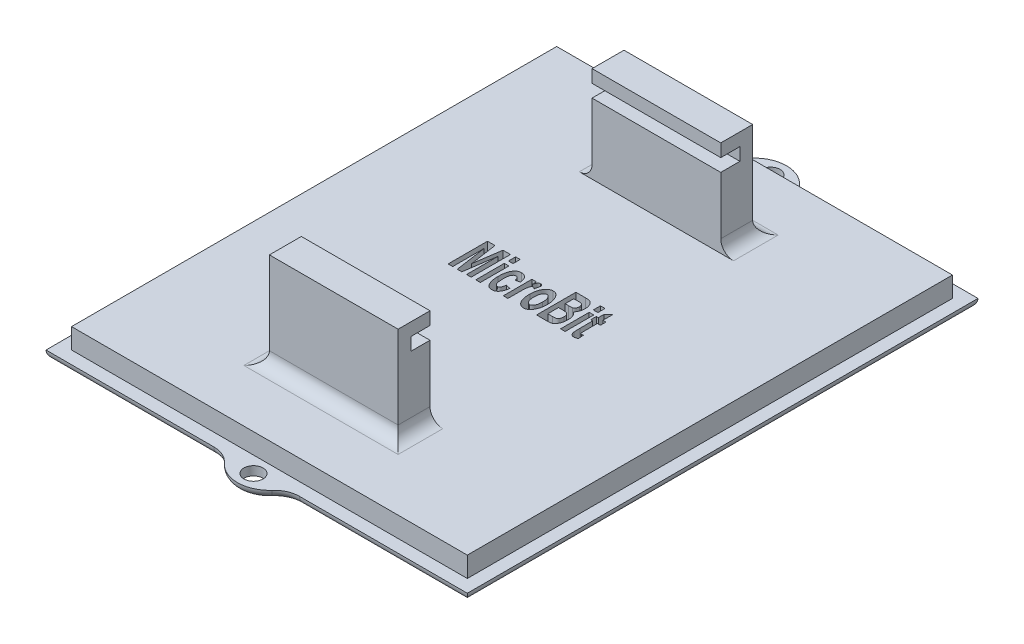
from build123d import *

# Parameters (mm, degrees)
SKETCH1_W           = 62
SKETCH1_H           = 76
BOSS_EXTRUDE1_DEPTH = 4.575
SKETCH11_W          = 66
SKETCH11_H          = 80
BOSS_EXTRUDE5_DEPTH = 1.4
BOSS_EXTRUDE3_DEPTH = 1.4
CUT_EXTRUDE3_REACH  = 56.296
SKETCH12_R          = 1.5
FILLET1_R           = 1.4
SKETCH5_W           = 0.720463423
SKETCH5_H           = 1.12072088
SKETCH5_H_2         = 4.482883523
SKETCH5_W_2         = 0.720463424
LETTERS_DEPTH       = 2
SKETCH21_W          = 20.158508521
SKETCH21_H          = 5
BOSS_EXTRUDE8_DEPTH = 15
SKETCH33_W          = 3
SKETCH33_H          = 2
CUT_EXTRUDE7_DEPTH  = 25
FILLET2_R           = 2


with BuildPart() as part:
    # Sketch1 → Boss-Extrude1 (new body)
    with BuildSketch(Plane(origin=(0, 0, 0), x_dir=(1, 0, 0), z_dir=(0, 1, 0))):
        Rectangle(SKETCH1_W, SKETCH1_H)
    extrude(amount=BOSS_EXTRUDE1_DEPTH)

    # Sketch11 → Boss-Extrude5 (add)
    with BuildSketch(Plane(origin=(0, 0, 0), x_dir=(-1, 0, 0), z_dir=(0, -1, 0))):
        Rectangle(SKETCH11_W, SKETCH11_H)
    extrude(amount=-BOSS_EXTRUDE5_DEPTH)

    # Sketch4 → Boss-Extrude3 (add)
    with BuildSketch(Plane(origin=(0, 0, 0), x_dir=(1, 0, 0), z_dir=(0, 1, 0))):
        with BuildLine():
            Line((-6.708203932, -40), (6.708203932, -40))
            ThreePointArc((6.708203932, -40), (5.075210771, -40.348516283), (3.726779962, -41.333333333))
            ThreePointArc((3.726779962, -41.333333333), (0, -43), (-3.726779962, -41.333333333))
            ThreePointArc((-3.726779962, -41.333333333), (-5.075210771, -40.348516283), (-6.708203932, -40))
        make_face()
    boss_extrude3 = extrude(amount=BOSS_EXTRUDE3_DEPTH)

    # Sketch12 → Cut-Extrude3 (cut, up to next)
    with BuildSketch(Plane(origin=(0, 1.4, 0), x_dir=(1, 0, 0), z_dir=(0, 1, 0)), mode=Mode.PRIVATE) as cut_extrude3_sk1:
        with Locations(Location((0, -40.5, 0), (0, 0, 270))):
            Circle(SKETCH12_R)
    cut_extrude3_tool1 = extrude(cut_extrude3_sk1.sketch, amount=-CUT_EXTRUDE3_REACH, mode=Mode.PRIVATE) & part.part
    cut_extrude3 = cut_extrude3_tool1.solids().sort_by_distance((0, 1.4, 40.5))[0]
    add(cut_extrude3, mode=Mode.SUBTRACT)

    # Mirror1: Boss-Extrude3, Cut-Extrude3 across plane
    add(boss_extrude3.mirror(Plane.XY))
    add(cut_extrude3.mirror(Plane.XY), mode=Mode.SUBTRACT)

    # Fillet1
    # the kernel refuses this fillet: 1.4 mm, written as the material it takes off along each edge
    with BuildSketch(Plane(origin=(6.708203932, 0, -40), x_dir=(0, 0, 1), z_dir=(1, 0, 0)), Plane(origin=(-36.5, 0, -40), x_dir=(0, 0, 1), z_dir=(1, 0, 0)), Plane(origin=(-6.708203932, 0, 40), x_dir=(0, 0, -1), z_dir=(-1, 0, 0)), Plane(origin=(36.5, 0, 40), x_dir=(0, 0, -1), z_dir=(-1, 0, 0))) as fillet1_piece_1:
        with BuildLine():
            CenterArc((FILLET1_R, -FILLET1_R), FILLET1_R, 90, 90)
            Line((0, -FILLET1_R), (0, 0))
            Line((0, 0), (FILLET1_R, 0))
        make_face()
    extrude(amount=29.791796068, mode=Mode.SUBTRACT)
    with BuildSketch(Plane(origin=(6.708203932, 0, -44), x_dir=(0, 0, 1), z_dir=(1, 0, 0))) as fillet1_piece_2:
        with BuildLine():
            CenterArc((4 + FILLET1_R, -FILLET1_R), FILLET1_R, 90, 90)
            Line((4, -FILLET1_R), (4, 0))
            Line((4, 0), (4 + FILLET1_R, 0))
        make_face()
    revolve(axis=Axis((6.708203932, 0, -44), (0, -1, 0)), revolution_arc=48.189685104, mode=Mode.SUBTRACT)
    with BuildSketch(Plane(origin=(0, 0, -38), x_dir=(0.7453559924999292, 0, -0.6666666666666675), z_dir=(0.6666666666666675, 0, 0.7453559924999292))) as fillet1_piece_3:
        with BuildLine():
            CenterArc((5 - FILLET1_R, FILLET1_R), FILLET1_R, 270, 90)
            Line((5, FILLET1_R), (5, 0))
            Line((5, 0), (5 - FILLET1_R, 0))
        make_face()
    revolve(axis=Axis((0, 0, -38), (0, 1, 0)), revolution_arc=96.379370208, mode=Mode.SUBTRACT)
    with BuildSketch(Plane(origin=(-6.708203932, 0, -44), x_dir=(0.7453559924999359, 0, 0.6666666666666601), z_dir=(0.6666666666666601, 0, -0.7453559924999359))) as fillet1_piece_4:
        with BuildLine():
            CenterArc((4 + FILLET1_R, -FILLET1_R), FILLET1_R, 90, 90)
            Line((4, -FILLET1_R), (4, 0))
            Line((4, 0), (4 + FILLET1_R, 0))
        make_face()
    revolve(axis=Axis((-6.708203932, 0, -44), (0, -1, 0)), revolution_arc=48.189685104, mode=Mode.SUBTRACT)
    with BuildSketch(Plane(origin=(-33, 0, 43.5), x_dir=(1, 0, 0), z_dir=(0, 0, -1)), Plane(origin=(33, 0, -43.5), x_dir=(-1, 0, 0), z_dir=(0, 0, 1))) as fillet1_piece_5:
        with BuildLine():
            CenterArc((FILLET1_R, -FILLET1_R), FILLET1_R, 90, 90)
            Line((0, -FILLET1_R), (0, 0))
            Line((0, 0), (FILLET1_R, 0))
        make_face()
    extrude(amount=87, mode=Mode.SUBTRACT)
    with BuildSketch(Plane(origin=(-6.708203932, 0, 44), x_dir=(0.7453559924999359, 0, -0.6666666666666601), z_dir=(0.6666666666666601, 0, 0.7453559924999359))) as fillet1_piece_6:
        with BuildLine():
            CenterArc((4 + FILLET1_R, FILLET1_R), FILLET1_R, 180, 90)
            Line((4, FILLET1_R), (4, 0))
            Line((4, 0), (4 + FILLET1_R, 0))
        make_face()
    revolve(axis=Axis((-6.708203932, 0, 44), (0, 1, 0)), revolution_arc=48.189685104, mode=Mode.SUBTRACT)
    with BuildSketch(Plane(origin=(0, 0, 38), x_dir=(0.7453559924999292, 0, 0.6666666666666675), z_dir=(0.6666666666666675, 0, -0.7453559924999292))) as fillet1_piece_7:
        with BuildLine():
            CenterArc((5 - FILLET1_R, -FILLET1_R), FILLET1_R, 0, 90)
            Line((5, -FILLET1_R), (5, 0))
            Line((5, 0), (5 - FILLET1_R, 0))
        make_face()
    revolve(axis=Axis((0, 0, 38), (0, -1, 0)), revolution_arc=96.379370208, mode=Mode.SUBTRACT)
    with BuildSketch(Plane(origin=(6.708203932, 0, 44), x_dir=(0, 0, -1), z_dir=(1, 0, 0))) as fillet1_piece_8:
        with BuildLine():
            CenterArc((4 + FILLET1_R, FILLET1_R), FILLET1_R, 180, 90)
            Line((4, FILLET1_R), (4, 0))
            Line((4, 0), (4 + FILLET1_R, 0))
        make_face()
    revolve(axis=Axis((6.708203932, 0, 44), (0, 1, 0)), revolution_arc=48.189685104, mode=Mode.SUBTRACT)

    # Sketch5 → Letters (cut)
    # profile 1 of 10: a face of its own
    with BuildSketch(Plane(origin=(0, 4.575, 0), x_dir=(1, 0, 0), z_dir=(0, 1, 0))):
        Polygon((-10.006436435, 0), (-10.006436435, 6.163964844), (-8.82692774, 6.163964844), (-8.205277876, 1.878708441), (-7.569869163, 6.163964844), (-6.404119318, 6.163964844), (-6.404119318, 0), (-7.124582741, 0), (-7.124582741, 4.931922358), (-7.85755421, 0), (-8.569262002, 0), (-9.285973011, 4.931922358), (-9.285973011, 0), align=None)
    # profile 2 of 10: a face of its own
    with BuildSketch(Plane(origin=(0, 4.575, 0), x_dir=(1, 0, 0), z_dir=(0, 1, 0))):
        with Locations((-5.323424184, 5.683655895)):
            Rectangle(SKETCH5_W, SKETCH5_H)
    # profile 3 of 10: a face of its own
    with BuildSketch(Plane(origin=(0, 4.575, 0), x_dir=(1, 0, 0), z_dir=(0, 1, 0))):
        with Locations((-5.323424184, 2.241441761)):
            Rectangle(SKETCH5_W, SKETCH5_H_2)
    # profile 4 of 10: a face of its own
    with BuildSketch(Plane(origin=(0, 4.575, 0), x_dir=(1, 0, 0), z_dir=(0, 1, 0))):
        with BuildLine():
            Line((-1.841184304, 3.202059659), (-2.561647727, 3.041956676))
            add(Edge.make_bspline(
                [(-2.561647727, 3.041956676), (-2.569415767, 3.092175905), (-2.58406832, 3.186902496), (-2.619771712, 3.318313553), (-2.667104922, 3.429656101), (-2.724529075, 3.522184519), (-2.794601312, 3.594585136), (-2.876949236, 3.645999071), (-2.970591912, 3.677119835), (-3.036713652, 3.680585796), (-3.070725181, 3.682368608)],
                knots=[0, 0, 0, 0, 1.347443994, 2.541631543, 3.60183602, 4.546855086, 5.415025027, 6.249789833, 7.099731444, 8, 8, 8, 8], degree=3))
            add(Edge.make_bspline(
                [(-3.070725181, 3.682368608), (-3.093340453, 3.681480194), (-3.137837925, 3.679732164), (-3.202158584, 3.663700201), (-3.263895926, 3.640121901), (-3.320926661, 3.60421503), (-3.376111323, 3.560183489), (-3.425297488, 3.503981254), (-3.473400881, 3.440107338), (-3.517468375, 3.365664951), (-3.55614382, 3.279071411), (-3.591377271, 3.180200304), (-3.619545923, 3.067457298), (-3.641400643, 2.941073356), (-3.660106052, 2.801743554), (-3.673926442, 2.648612112), (-3.68097533, 2.482081661), (-3.681892186, 2.366528182), (-3.682368608, 2.306483598)],
                knots=[0, 0, 0, 0, 0.653952693, 1.286707604, 1.910173864, 2.56054813, 3.23014942, 3.948308205, 4.716418548, 5.544914348, 6.447474048, 7.459723416, 8.58159871, 9.808722421, 11.173440023, 12.652828902, 14.260723113, 16, 16, 16, 16], degree=3))
            add(Edge.make_bspline(
                [(-3.682368608, 2.306483598), (-3.681951943, 2.240181062), (-3.681152388, 2.112950383), (-3.673344585, 1.92943313), (-3.661954944, 1.7611394), (-3.642368234, 1.607755771), (-3.620844281, 1.469382679), (-3.593699631, 1.345447483), (-3.560164675, 1.237256559), (-3.522628532, 1.142818846), (-3.479900577, 1.062067335), (-3.433158987, 0.992997984), (-3.384879837, 0.93309132), (-3.331449406, 0.885033815), (-3.275017186, 0.846446471), (-3.214108085, 0.820543468), (-3.150519744, 0.802866536), (-3.106703335, 0.801306174), (-3.084484031, 0.800514915)],
                knots=[0, 0, 0, 0, 1.798001022, 3.450258536, 4.980924576, 6.370801408, 7.642305822, 8.777998934, 9.808017779, 10.710903135, 11.53035003, 12.2798791, 12.970457311, 13.610893161, 14.222428263, 14.814848151, 15.399009397, 16, 16, 16, 16], degree=3))
            add(Edge.make_bspline(
                [(-3.084484031, 0.800514915), (-3.051606238, 0.802904842), (-2.986663507, 0.807625609), (-2.894914444, 0.846201993), (-2.813814247, 0.90901051), (-2.756630384, 0.979719625), (-2.715954214, 1.048924052), (-2.685589559, 1.111295227), (-2.660549472, 1.184422762), (-2.635110558, 1.265546173), (-2.612769772, 1.356213883), (-2.593087009, 1.456006846), (-2.57541787, 1.565299764), (-2.566363112, 1.64143361), (-2.561647727, 1.681081321)],
                knots=[0, 0, 0, 0, 1.052803843, 2.079578714, 3.139931458, 4.319283822, 4.973649928, 5.716166048, 6.541994899, 7.452471082, 8.446066745, 9.538310016, 10.718042264, 12, 12, 12, 12], degree=3))
            Line((-2.561647727, 1.681081321), (-1.841184304, 1.520978338))
            add(Edge.make_bspline(
                [(-1.841184304, 1.520978338), (-1.850438105, 1.45622145), (-1.868427924, 1.330331043), (-1.907060708, 1.149142847), (-1.948384373, 0.97953323), (-1.998736088, 0.823049194), (-2.054719727, 0.678732173), (-2.117182974, 0.546895782), (-2.185909331, 0.427446867), (-2.261117666, 0.320558724), (-2.342566616, 0.225511461), (-2.431778586, 0.144457341), (-2.526328825, 0.074181423), (-2.628293346, 0.01792899), (-2.736605027, -0.026228261), (-2.851257408, -0.057368176), (-2.9720923, -0.076656507), (-3.054808336, -0.078904867), (-3.096992077, -0.080051491)],
                knots=[0, 0, 0, 0, 1.397562585, 2.716926754, 3.957387357, 5.126818082, 6.227165444, 7.263413005, 8.241524602, 9.168586725, 10.052913959, 10.910625063, 11.739335748, 12.564974991, 13.392295341, 14.233179615, 15.098952307, 16, 16, 16, 16], degree=3))
            add(Edge.make_bspline(
                [(-3.096992077, -0.080051491), (-3.150563194, -0.078488552), (-3.255422485, -0.075429277), (-3.406793666, -0.04083068), (-3.548920331, 0.010305846), (-3.677793377, 0.088331835), (-3.798040664, 0.183087123), (-3.904818851, 0.302120925), (-4.001431065, 0.440918055), (-4.086400893, 0.599288964), (-4.160007795, 0.772452367), (-4.224996746, 0.955050223), (-4.280391007, 1.146294258), (-4.324893358, 1.346049654), (-4.360151575, 1.554785401), (-4.384636945, 1.771919108), (-4.400108793, 1.997726191), (-4.401913409, 2.150941184), (-4.402832031, 2.228933716)],
                knots=[0, 0, 0, 0, 0.871335986, 1.705539791, 2.518217913, 3.322216255, 4.148776725, 5.004773818, 5.917026023, 6.898996254, 7.927594745, 8.980563789, 10.055657359, 11.169882491, 12.313627008, 13.503576332, 14.729220965, 16, 16, 16, 16], degree=3))
            add(Edge.make_bspline(
                [(-4.402832031, 2.228933716), (-4.401464905, 2.321097387), (-4.39880889, 2.500150355), (-4.383123899, 2.760305847), (-4.354825608, 3.003881155), (-4.313328635, 3.23010435), (-4.262728792, 3.439724466), (-4.200798883, 3.632209339), (-4.12529997, 3.80699595), (-4.039427746, 3.965174689), (-3.943046365, 4.10496164), (-3.840461345, 4.227821972), (-3.729784115, 4.331543425), (-3.611523579, 4.415946868), (-3.486350805, 4.482388376), (-3.353385693, 4.528276056), (-3.21345524, 4.558854501), (-3.11717024, 4.56155978), (-3.068223572, 4.562935014)],
                knots=[0, 0, 0, 0, 1.480403806, 2.876086558, 4.184392852, 5.416521724, 6.568123854, 7.646082557, 8.65997895, 9.622034346, 10.532252541, 11.382870141, 12.188398895, 12.961453918, 13.710344977, 14.455904881, 15.215056218, 16, 16, 16, 16], degree=3))
            add(Edge.make_bspline(
                [(-3.068223572, 4.562935014), (-3.028575991, 4.561978344), (-2.951068687, 4.560108142), (-2.837706838, 4.545364597), (-2.730870416, 4.518172298), (-2.628459995, 4.483778744), (-2.532109001, 4.437153394), (-2.441354684, 4.380223844), (-2.35596462, 4.313898678), (-2.276546593, 4.236534842), (-2.202405506, 4.148825752), (-2.134903594, 4.048409506), (-2.070739743, 3.937297863), (-2.013759748, 3.813123011), (-1.962504233, 3.677133045), (-1.91671003, 3.529577007), (-1.875061966, 3.370190792), (-1.852718978, 3.259304988), (-1.841184304, 3.202059659)],
                knots=[0, 0, 0, 0, 0.943294595, 1.844052543, 2.712659931, 3.562887164, 4.410389768, 5.25270882, 6.108014149, 6.977980152, 7.886191725, 8.835518475, 9.853144629, 10.936129977, 12.082166347, 13.308999365, 14.610757988, 16, 16, 16, 16], degree=3))
        make_face()
    # profile 5 of 10: a face of its own
    with BuildSketch(Plane(origin=(0, 4.575, 0), x_dir=(1, 0, 0), z_dir=(0, 1, 0))):
        with BuildLine():
            Line((-0.640411932, 0), (-1.360875355, 0))
            Line((-1.360875355, 0), (-1.360875355, 4.482883523))
            Line((-1.360875355, 4.482883523), (-0.640411932, 4.482883523))
            Line((-0.640411932, 4.482883523), (-0.640411932, 3.846224005))
            add(Edge.make_bspline(
                [(-0.640411932, 3.846224005), (-0.628032007, 3.881710365), (-0.604222872, 3.949957916), (-0.568019215, 4.047139641), (-0.533652779, 4.135209589), (-0.497971226, 4.212131681), (-0.466340695, 4.280608732), (-0.433256796, 4.3381647), (-0.402642575, 4.387093409), (-0.363561579, 4.438297371), (-0.310897715, 4.486909117), (-0.243882034, 4.531455931), (-0.1702871, 4.557728926), (-0.119440816, 4.561190242), (-0.093810342, 4.562935014)],
                knots=[0, 0, 0, 0, 1.407544315, 2.706996432, 3.88427009, 4.946569811, 5.882446341, 6.707549214, 7.430927138, 8.043118681, 9.114674348, 10.097942534, 11.041215361, 12, 12, 12, 12], degree=3))
            add(Edge.make_bspline(
                [(-0.093810342, 4.562935014), (-0.057499169, 4.560374916), (0.0163768, 4.555166333), (0.123013261, 4.507701002), (0.22715949, 4.436812131), (0.28799561, 4.372886912), (0.320205966, 4.339040999)],
                knots=[0, 0, 0, 0, 0.895150057, 1.821204655, 2.846412748, 4, 4, 4, 4], degree=3))
            Line((0.320205966, 4.339040999), (0.09881356, 3.328390919))
            add(Edge.make_bspline(
                [(0.09881356, 3.328390919), (0.073039233, 3.357709895), (0.025622976, 3.411647139), (-0.053003521, 3.472875252), (-0.129771301, 3.513825744), (-0.182626594, 3.519554995), (-0.207633556, 3.522265625)],
                knots=[0, 0, 0, 0, 1.252290691, 2.303801736, 3.197492555, 4, 4, 4, 4], degree=3))
            add(Edge.make_bspline(
                [(-0.207633556, 3.522265625), (-0.229639464, 3.52071238), (-0.274728029, 3.51752989), (-0.33822927, 3.485962544), (-0.397521354, 3.437817591), (-0.452009653, 3.368912645), (-0.501922222, 3.276114318), (-0.539687108, 3.153243943), (-0.572809098, 3.00184035), (-0.594089467, 2.853964111), (-0.60597155, 2.713879934), (-0.616766771, 2.584720539), (-0.623336704, 2.434930556), (-0.629748341, 2.264823385), (-0.634487829, 2.074267294), (-0.638660607, 1.862882625), (-0.63901791, 1.630630335), (-0.639934657, 1.468860783), (-0.640411932, 1.384640642)],
                knots=[0, 0, 0, 0, 0.455174481, 0.932620676, 1.444745929, 2.036817955, 2.747170909, 3.625029935, 4.700533201, 5.971547284, 6.72946565, 7.625692715, 8.668005912, 9.848617431, 11.167690078, 12.634014002, 14.247607075, 16, 16, 16, 16], degree=3))
            Line((-0.640411932, 1.384640642), (-0.640411932, 0))
        make_face()
    # profile 6 of 10: a face of its own
    with BuildSketch(Plane(origin=(0, 4.575, 0), x_dir=(1, 0, 0), z_dir=(0, 1, 0))):
        with BuildLine():
            add(Edge.make_bspline(
                [(0.480308949, 2.303981989), (0.482718128, 2.410404936), (0.487447001, 2.619297988), (0.524330571, 2.924803604), (0.584192604, 3.215729644), (0.654189875, 3.44645854), (0.721069658, 3.62070998), (0.774824186, 3.742241597), (0.832314928, 3.855740557), (0.894662842, 3.959599876), (0.959161195, 4.056501008), (1.026986066, 4.144932464), (1.100454193, 4.224223623), (1.200272744, 4.317731505), (1.332969224, 4.41670896), (1.506455338, 4.501223603), (1.690074006, 4.554252872), (1.81623215, 4.560021214), (1.879959245, 4.562935014)],
                knots=[0, 0, 0, 0, 1.739754581, 3.414889862, 5.023331204, 6.591153363, 7.350788374, 8.07413214, 8.763188209, 9.429614607, 10.053576947, 10.665847298, 11.249635028, 11.818789968, 12.901436432, 13.941117902, 14.959983318, 16, 16, 16, 16], degree=3))
            add(Edge.make_bspline(
                [(1.879959245, 4.562935014), (1.933046037, 4.560597105), (2.037650664, 4.555990384), (2.190319172, 4.524747015), (2.333397853, 4.469822792), (2.467972255, 4.394112047), (2.59180668, 4.294448764), (2.709616239, 4.176488695), (2.815529428, 4.034511318), (2.911446457, 3.874056077), (2.998163387, 3.699808397), (3.074409184, 3.516396001), (3.137966043, 3.325586796), (3.190838276, 3.128076017), (3.232254616, 2.923015094), (3.260266219, 2.710272619), (3.278425502, 2.49066588), (3.280870012, 2.341959703), (3.282111151, 2.266457852)],
                knots=[0, 0, 0, 0, 0.856934198, 1.688542078, 2.502308837, 3.322121042, 4.170421256, 5.060418754, 6.006761195, 7.021391695, 8.074902537, 9.146109931, 10.225217581, 11.319085367, 12.445034116, 13.599666462, 14.781290534, 16, 16, 16, 16], degree=3))
            add(Edge.make_bspline(
                [(3.282111151, 2.266457852), (3.279702671, 2.155037599), (3.27498971, 1.937008178), (3.238317266, 1.618088898), (3.177366411, 1.315462152), (3.105745267, 1.076253744), (3.039160642, 0.895668989), (2.983595442, 0.77098824), (2.926478295, 0.65407386), (2.864913584, 0.545713575), (2.798917162, 0.445791916), (2.728677102, 0.354655163), (2.656181088, 0.270844958), (2.554319833, 0.174665884), (2.420778555, 0.073835606), (2.248793019, -0.014471243), (2.068495554, -0.070144368), (1.94455312, -0.07674482), (1.882460854, -0.080051491)],
                knots=[0, 0, 0, 0, 1.777630946, 3.478504418, 5.114714351, 6.697655826, 7.457657535, 8.184525214, 8.87481742, 9.533342784, 10.171800573, 10.78392461, 11.368492025, 11.937908158, 13.017048985, 14.025738842, 15.010941249, 16, 16, 16, 16], degree=3))
            add(Edge.make_bspline(
                [(1.882460854, -0.080051491), (1.833126014, -0.078071948), (1.735688516, -0.074162302), (1.592736214, -0.044663392), (1.456530956, 0.00472561), (1.326717089, 0.073150446), (1.202968725, 0.159960419), (1.087454894, 0.268417315), (0.977409696, 0.394795437), (0.875310156, 0.540516082), (0.781019832, 0.703094758), (0.700214212, 0.883454331), (0.632944724, 1.080521363), (0.576778372, 1.293239774), (0.533410071, 1.522747193), (0.502552839, 1.768779725), (0.483675368, 2.031009951), (0.481450837, 2.211389948), (0.480308949, 2.303981989)],
                knots=[0, 0, 0, 0, 0.771958132, 1.524635918, 2.274108935, 3.033183731, 3.81547548, 4.633024056, 5.50737879, 6.434585393, 7.414184396, 8.445393942, 9.522888597, 10.670700671, 11.886797803, 13.176461281, 14.550630786, 16, 16, 16, 16], degree=3))
        make_face()
        with BuildLine():
            add(Edge.make_bspline(
                [(1.200772372, 2.241441761), (1.201709427, 2.187235755), (1.203527084, 2.082089392), (1.211324187, 1.929186695), (1.228459928, 1.786615238), (1.248348101, 1.653853467), (1.277702182, 1.531551095), (1.312439238, 1.419606331), (1.351866675, 1.316787343), (1.399732662, 1.226173642), (1.450897085, 1.145108213), (1.506364806, 1.075676176), (1.561695934, 1.013914774), (1.622840186, 0.966794875), (1.684808712, 0.927821508), (1.749801831, 0.900485902), (1.817753256, 0.882976234), (1.864008265, 0.881377248), (1.887464072, 0.880566406)],
                knots=[0, 0, 0, 0, 1.556678143, 3.019573961, 4.393142381, 5.678311651, 6.871720797, 8.000071596, 9.042671446, 10.027885058, 10.937779578, 11.790348481, 12.577999173, 13.310890625, 13.998691348, 14.674617145, 15.327901432, 16, 16, 16, 16], degree=3))
            add(Edge.make_bspline(
                [(1.887464072, 0.880566406), (1.910504059, 0.881377797), (1.95593857, 0.882977847), (2.022665627, 0.900488094), (2.086354842, 0.92790735), (2.1475261, 0.966738604), (2.206587326, 1.015338006), (2.261092095, 1.076912813), (2.315620388, 1.146629399), (2.364925626, 1.228502293), (2.411596044, 1.320170915), (2.452832121, 1.422509975), (2.486170335, 1.535763888), (2.513061277, 1.658779183), (2.536443312, 1.791755037), (2.549923511, 1.935627223), (2.561101291, 2.089503985), (2.561461915, 2.195554743), (2.561647727, 2.250197393)],
                knots=[0, 0, 0, 0, 0.660393245, 1.302285633, 1.967439311, 2.64530034, 3.37669002, 4.156479444, 5.002005497, 5.915997461, 6.896089777, 7.954620151, 9.079873129, 10.282682905, 11.570260259, 12.954922579, 14.431023942, 16, 16, 16, 16], degree=3))
            add(Edge.make_bspline(
                [(2.561647727, 2.250197393), (2.560709593, 2.303569396), (2.558890706, 2.407048951), (2.551118036, 2.557458426), (2.533866566, 2.697929202), (2.514076906, 2.82903785), (2.484762049, 2.950109564), (2.449735503, 3.06111373), (2.410607996, 3.16361409), (2.362408884, 3.254476916), (2.31163698, 3.335785251), (2.257568349, 3.406961251), (2.200260364, 3.466671526), (2.141243254, 3.516699671), (2.079006892, 3.554549818), (2.014495585, 3.582948745), (1.946676617, 3.599613887), (1.900475322, 3.6014182), (1.877457636, 3.602317116)],
                knots=[0, 0, 0, 0, 1.543216374, 2.992043267, 4.351050057, 5.633102205, 6.822942095, 7.947500436, 8.997225086, 9.989171339, 10.915455685, 11.766456908, 12.567781992, 13.303907758, 13.996408695, 14.66586955, 15.335330404, 16, 16, 16, 16], degree=3))
            add(Edge.make_bspline(
                [(1.877457636, 3.602317116), (1.854417982, 3.601505423), (1.808984128, 3.599904777), (1.742252193, 3.582398962), (1.678582178, 3.554962263), (1.617335345, 3.516199666), (1.55836736, 3.467135246), (1.502417334, 3.406484197), (1.448299194, 3.335815626), (1.397223771, 3.254817829), (1.350915588, 3.162647012), (1.309791121, 3.060737906), (1.276229528, 2.948389587), (1.249200001, 2.826221019), (1.22620711, 2.694436566), (1.212381447, 2.551857916), (1.201367874, 2.400048349), (1.200974398, 2.295249503), (1.200772372, 2.241441761)],
                knots=[0, 0, 0, 0, 0.66322814, 1.307876003, 1.975885011, 2.656655919, 3.391185263, 4.182498677, 5.031654351, 5.955929882, 6.940229476, 8.003303844, 9.121872868, 10.318114021, 11.611218606, 12.977903235, 14.448339751, 16, 16, 16, 16], degree=3))
        make_face(mode=Mode.SUBTRACT)
    # profile 7 of 10: a face of its own
    with BuildSketch(Plane(origin=(0, 4.575, 0), x_dir=(1, 0, 0), z_dir=(0, 1, 0))):
        with BuildLine():
            Line((3.842471591, 6.163964844), (5.344687861, 6.163964844))
            add(Edge.make_bspline(
                [(5.344687861, 6.163964844), (5.394304419, 6.163358765), (5.489409443, 6.162197035), (5.626390275, 6.156906642), (5.751903488, 6.143734353), (5.865881015, 6.128003087), (5.969063773, 6.108700313), (6.05988184, 6.08196877), (6.140573137, 6.053122416), (6.232635991, 6.004951992), (6.336566179, 5.927260289), (6.446626815, 5.806894435), (6.54901306, 5.66023481), (6.636142564, 5.486421928), (6.711263924, 5.293723251), (6.766575285, 5.08583764), (6.797599881, 4.864481309), (6.802078979, 4.713127052), (6.804376776, 4.635481678)],
                knots=[0, 0, 0, 0, 0.97292557, 1.864903826, 2.686450071, 3.445992779, 4.120937143, 4.741890865, 5.300647567, 5.797894589, 6.773974564, 7.826575111, 8.983142181, 10.270078414, 11.62877496, 13.0326338, 14.477728602, 16, 16, 16, 16], degree=3))
            add(Edge.make_bspline(
                [(6.804376776, 4.635481678), (6.802879102, 4.564089523), (6.799942083, 4.424085612), (6.771503534, 4.219743396), (6.726766126, 4.025703562), (6.664752838, 3.844812162), (6.589608852, 3.679987646), (6.501781744, 3.536171008), (6.403874215, 3.413410629), (6.32644753, 3.349336529), (6.289045299, 3.318384483)],
                knots=[0, 0, 0, 0, 1.172421032, 2.299181576, 3.38260476, 4.439807611, 5.435964538, 6.35240003, 7.204099777, 8, 8, 8, 8], degree=3))
            add(Edge.make_bspline(
                [(6.289045299, 3.318384483), (6.340434037, 3.288600308), (6.444296552, 3.228403087), (6.578210525, 3.1002024), (6.693458705, 2.944388815), (6.790466498, 2.761535751), (6.869114302, 2.554977096), (6.924662646, 2.32514533), (6.958579054, 2.074430655), (6.962468279, 1.900084663), (6.964479759, 1.80991419)],
                knots=[0, 0, 0, 0, 0.819022201, 1.655337504, 2.541002995, 3.49037165, 4.508760589, 5.589782824, 6.753453293, 8, 8, 8, 8], degree=3))
            add(Edge.make_bspline(
                [(6.964479759, 1.80991419), (6.963793382, 1.75402533), (6.962449908, 1.6446317), (6.950920566, 1.483901477), (6.932296354, 1.329840066), (6.906433481, 1.182312976), (6.872046198, 1.041829775), (6.83281435, 0.907202884), (6.7836287, 0.779515725), (6.727592849, 0.658997692), (6.667205221, 0.547303617), (6.602696945, 0.446555071), (6.537287213, 0.356263835), (6.467642476, 0.277595318), (6.395358009, 0.210483689), (6.321414899, 0.152639048), (6.242970005, 0.108569802), (6.188407861, 0.086967181), (6.161463235, 0.076299078)],
                knots=[0, 0, 0, 0, 1.329635076, 2.602551002, 3.83177101, 5.020743121, 6.163630403, 7.271539973, 8.354838235, 9.415600219, 10.432162945, 11.373324619, 12.26022279, 13.082400334, 13.868538126, 14.60463836, 15.310923385, 16, 16, 16, 16], degree=3))
            add(Edge.make_bspline(
                [(6.161463235, 0.076299078), (6.139432799, 0.070195214), (6.089973956, 0.056491898), (6.005213429, 0.040253755), (5.901823804, 0.029342914), (5.779771742, 0.01701204), (5.639062832, 0.011026095), (5.47941562, 0.004116803), (5.301340287, 0.000697009), (5.176246779, 0.000239439), (5.110787409, 0)],
                knots=[0, 0, 0, 0, 0.51936907, 1.1659957, 1.958061688, 2.881030339, 3.953150927, 5.157337786, 6.512481738, 8, 8, 8, 8], degree=3))
            Line((5.110787409, 0), (3.842471591, 0))
            Line((3.842471591, 0), (3.842471591, 6.163964844))
        make_face()
        with BuildLine():
            Line((4.562935014, 5.123295455), (4.562935014, 3.762420099))
            Line((4.562935014, 3.762420099), (5.0807681, 3.762420099))
            add(Edge.make_bspline(
                [(5.0807681, 3.762420099), (5.117876504, 3.762277558), (5.188343383, 3.762006881), (5.288398059, 3.763812353), (5.377233261, 3.764363761), (5.454752714, 3.767470768), (5.521117184, 3.769187815), (5.576086233, 3.773541162), (5.620046781, 3.77633037), (5.645317411, 3.780603314), (5.656138195, 3.782432972)],
                knots=[0, 0, 0, 0, 1.545743879, 2.935285125, 4.16852895, 5.245899403, 6.167053727, 6.933015916, 7.543121653, 8, 8, 8, 8], degree=3))
            add(Edge.make_bspline(
                [(5.656138195, 3.782432972), (5.688256219, 3.79079899), (5.750949942, 3.807129286), (5.837301617, 3.852445464), (5.911625904, 3.914429907), (5.974284423, 3.993200353), (6.024097076, 4.087213242), (6.058801861, 4.197377203), (6.079891597, 4.321975413), (6.082528272, 4.410246612), (6.083913352, 4.456616627)],
                knots=[0, 0, 0, 0, 0.911397765, 1.779029707, 2.659324076, 3.55739798, 4.533026168, 5.57113304, 6.72408443, 8, 8, 8, 8], degree=3))
            add(Edge.make_bspline(
                [(6.083913352, 4.456616627), (6.08256742, 4.498347299), (6.080012407, 4.577565554), (6.064838692, 4.691016122), (6.034390569, 4.791317525), (5.994596189, 4.879139751), (5.947374149, 4.953732338), (5.893667967, 5.013091306), (5.834601494, 5.057988092), (5.77806169, 5.081721255), (5.723798901, 5.095364356), (5.667414421, 5.101135861), (5.596296834, 5.109745308), (5.509778126, 5.113208783), (5.408137222, 5.11943695), (5.290892131, 5.120504025), (5.158336464, 5.124124706), (5.064928238, 5.123581555), (5.015726263, 5.123295455)],
                knots=[0, 0, 0, 0, 1.333735276, 2.531859112, 3.644437664, 4.669699927, 5.604525458, 6.453087242, 7.215050613, 7.954919955, 8.394301585, 8.999038448, 9.762514, 10.683186281, 11.7634788, 13.01590914, 14.428155952, 16, 16, 16, 16], degree=3))
            Line((5.015726263, 5.123295455), (4.562935014, 5.123295455))
        make_face(mode=Mode.SUBTRACT)
        with BuildLine():
            Line((4.562935014, 2.72175071), (4.562935014, 1.040669389))
            Line((4.562935014, 1.040669389), (5.298408092, 1.040669389))
            add(Edge.make_bspline(
                [(5.298408092, 1.040669389), (5.336766132, 1.041015903), (5.410154586, 1.041678869), (5.514855248, 1.043727999), (5.609124237, 1.048744448), (5.692643826, 1.055766972), (5.765143439, 1.066096462), (5.826828812, 1.076455998), (5.877282655, 1.090491361), (5.931659548, 1.10984438), (5.98947728, 1.147240339), (6.049705047, 1.206346223), (6.105777636, 1.280076547), (6.153039301, 1.370490304), (6.195411916, 1.474200439), (6.222755665, 1.592813613), (6.240666119, 1.723894395), (6.242865708, 1.815683162), (6.244016335, 1.863698786)],
                knots=[0, 0, 0, 0, 1.234790772, 2.362461338, 3.370455331, 4.273250416, 5.059029203, 5.727651389, 6.284414341, 6.743085376, 7.58100201, 8.473261198, 9.450313537, 10.549266958, 11.748012238, 13.046786833, 14.455144607, 16, 16, 16, 16], degree=3))
            add(Edge.make_bspline(
                [(6.244016335, 1.863698786), (6.242936018, 1.912965157), (6.240867399, 2.007301666), (6.221997743, 2.141941942), (6.191450691, 2.263239383), (6.147195772, 2.370147072), (6.094180389, 2.463436901), (6.030708751, 2.540730094), (5.960148032, 2.60384777), (5.892028344, 2.642652184), (5.829657085, 2.666295953), (5.77154791, 2.68032356), (5.703315088, 2.694684401), (5.623698422, 2.703406047), (5.534172758, 2.713102368), (5.433506136, 2.716843202), (5.322212078, 2.721284055), (5.244213285, 2.721590272), (5.203346946, 2.72175071)],
                knots=[0, 0, 0, 0, 1.482231107, 2.838214062, 4.083198727, 5.236845195, 6.310953812, 7.300815434, 8.234675164, 9.145308561, 9.641788331, 10.238409427, 10.942330141, 11.739330464, 12.647192286, 13.652448031, 14.770034101, 16, 16, 16, 16], degree=3))
            Line((5.203346946, 2.72175071), (4.562935014, 2.72175071))
        make_face(mode=Mode.SUBTRACT)
    # profile 8 of 10: a face of its own
    with BuildSketch(Plane(origin=(0, 4.575, 0), x_dir=(1, 0, 0), z_dir=(0, 1, 0))):
        with Locations((7.965123402, 5.683655895)):
            Rectangle(SKETCH5_W_2, SKETCH5_H)
    # profile 9 of 10: a face of its own
    with BuildSketch(Plane(origin=(0, 4.575, 0), x_dir=(1, 0, 0), z_dir=(0, 1, 0))):
        with Locations((7.965123402, 2.241441761)):
            Rectangle(SKETCH5_W_2, SKETCH5_H_2)
    # profile 10 of 10: a face of its own
    with BuildSketch(Plane(origin=(0, 4.575, 0), x_dir=(1, 0, 0), z_dir=(0, 1, 0))):
        with BuildLine():
            Line((10.246590909, 4.482883523), (10.246590909, 3.602317116))
            Line((10.246590909, 3.602317116), (9.76628196, 3.602317116))
            Line((9.76628196, 3.602317116), (9.76628196, 1.749875572))
            add(Edge.make_bspline(
                [(9.76628196, 1.749875572), (9.766192398, 1.702344997), (9.766023483, 1.612701937), (9.767136071, 1.485942328), (9.769858264, 1.375045886), (9.772396827, 1.279987668), (9.774488129, 1.200730291), (9.777992921, 1.137311026), (9.782593801, 1.08970548), (9.787028906, 1.063586651), (9.788796442, 1.053177435)],
                knots=[0, 0, 0, 0, 1.635283238, 3.08415782, 4.361148623, 5.451714873, 6.3558793, 7.088717986, 7.636823994, 8, 8, 8, 8], degree=3))
            add(Edge.make_bspline(
                [(9.788796442, 1.053177435), (9.796985218, 1.027524933), (9.81200468, 0.980474338), (9.853170969, 0.923110893), (9.908248651, 0.886563902), (9.950042679, 0.882595589), (9.971413907, 0.880566406)],
                knots=[0, 0, 0, 0, 1.183320274, 2.170389647, 3.064435216, 4, 4, 4, 4], degree=3))
            add(Edge.make_bspline(
                [(9.971413907, 0.880566406), (9.990293872, 0.882454165), (10.033114625, 0.8867357), (10.101733106, 0.909754924), (10.18070208, 0.946966256), (10.235567655, 0.978513899), (10.265352977, 0.995640425)],
                knots=[0, 0, 0, 0, 0.713010574, 1.61714546, 2.706400336, 4, 4, 4, 4], degree=3))
            Line((10.265352977, 0.995640425), (10.326642401, 0.097562755))
            add(Edge.make_bspline(
                [(10.326642401, 0.097562755), (10.284084839, 0.070186554), (10.199885293, 0.016023118), (10.059312734, -0.038382784), (9.911498042, -0.074050598), (9.809441967, -0.078028132), (9.757526328, -0.080051491)],
                knots=[0, 0, 0, 0, 1.000745267, 1.979960678, 2.97241167, 4, 4, 4, 4], degree=3))
            add(Edge.make_bspline(
                [(9.757526328, -0.080051491), (9.713501607, -0.0780745), (9.628218792, -0.074244755), (9.507744831, -0.039468041), (9.400135482, 0.016298323), (9.309097032, 0.097668811), (9.232161163, 0.19955313), (9.170499822, 0.321583213), (9.119193134, 0.461564158), (9.099776929, 0.563303204), (9.089596696, 0.616646645)],
                knots=[0, 0, 0, 0, 0.991111413, 1.919938812, 2.803427513, 3.703184803, 4.649324697, 5.667290817, 6.776922528, 8, 8, 8, 8], degree=3))
            add(Edge.make_bspline(
                [(9.089596696, 0.616646645), (9.086062792, 0.639969811), (9.078196252, 0.691887645), (9.070107958, 0.777909101), (9.062538975, 0.880071332), (9.056553387, 0.998102816), (9.051693264, 1.132368418), (9.047584468, 1.282050728), (9.047199227, 1.448017052), (9.046293962, 1.563923523), (9.045818537, 1.624795116)],
                knots=[0, 0, 0, 0, 0.560503876, 1.247692828, 2.052472268, 2.99507332, 4.056012921, 5.245392702, 6.553339334, 8, 8, 8, 8], degree=3))
            Line((9.045818537, 1.624795116), (9.045818537, 3.602317116))
            Line((9.045818537, 3.602317116), (8.725612571, 3.602317116))
            Line((8.725612571, 3.602317116), (8.725612571, 4.482883523))
            Line((8.725612571, 4.482883523), (9.045818537, 4.482883523))
            Line((9.045818537, 4.482883523), (9.045818537, 5.383462802))
            Line((9.045818537, 5.383462802), (9.76628196, 6.083913352))
            Line((9.76628196, 6.083913352), (9.76628196, 4.482883523))
            Line((9.76628196, 4.482883523), (10.246590909, 4.482883523))
        make_face()
    extrude(amount=-LETTERS_DEPTH, mode=Mode.SUBTRACT)

    # Sketch21 → Boss-Extrude8 (add)
    with BuildSketch(Plane(origin=(0, 4.575, 0), x_dir=(1, 0, 0), z_dir=(0, 1, 0))):
        with Locations((-0.149821344, -25.272162816)):
            Rectangle(SKETCH21_W, SKETCH21_H)
    boss_extrude8 = extrude(amount=BOSS_EXTRUDE8_DEPTH)

    # Sketch33 → Cut-Extrude7 (cut)
    with BuildSketch(Plane(origin=(9.929432917, 0, 0), x_dir=(0, 0, -1), z_dir=(1, 0, 0))):
        with Locations((-24.272162816, 16.575)):
            Rectangle(SKETCH33_W, SKETCH33_H)
    cut_extrude7 = extrude(amount=-CUT_EXTRUDE7_DEPTH, mode=Mode.SUBTRACT)

    # Mirror2: Boss-Extrude8, Cut-Extrude7 across plane
    add(boss_extrude8.mirror(Plane.XY))
    add(cut_extrude7.mirror(Plane.XY), mode=Mode.SUBTRACT)

    # Fillet2
    fillet2_edges = [part.edges().sort_by_distance(p)[0] for p in [
        (-10.229075604, 4.575, 25.272162816),
        (-0.149821344, 4.575, 27.772162816),
        (9.929432917, 4.575, 25.272162816),
        (9.929432917, 4.575, -25.272162816),
        (-10.229075604, 4.575, -25.272162816),
        (-0.149821344, 4.575, -27.772162816),
    ]]
    fillet(fillet2_edges, radius=FILLET2_R)


solid = part.part
